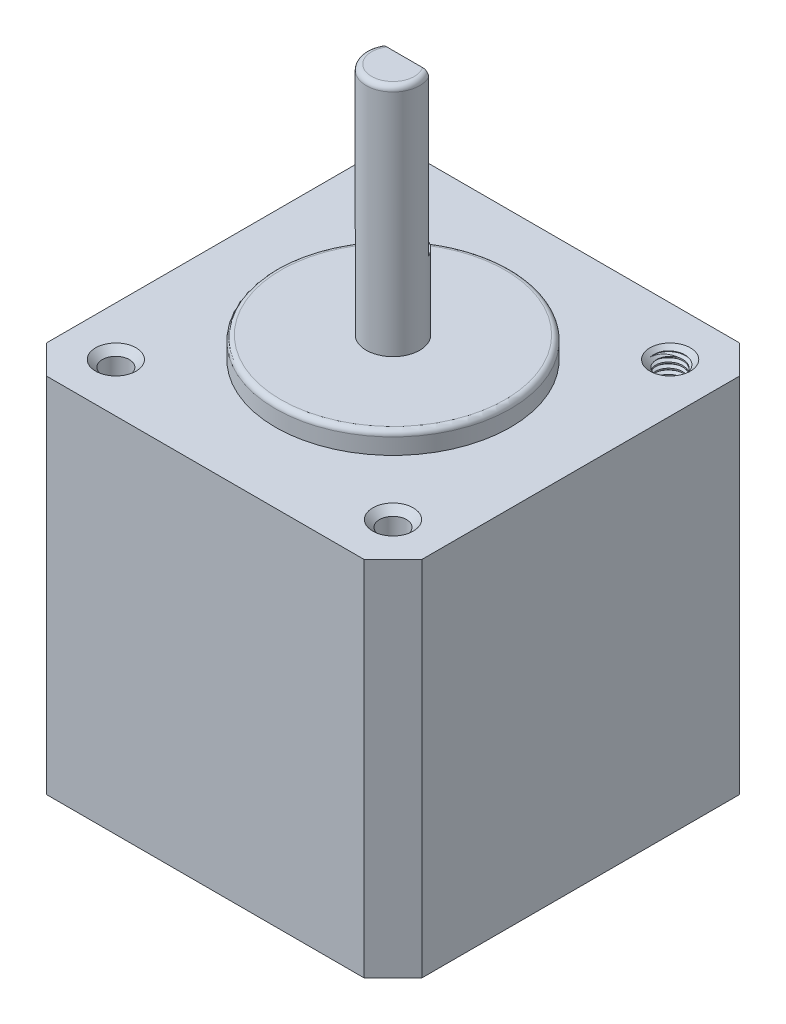
from build123d import *

# Parameters (mm, degrees)
SKETCH1_W                              = 35.2
SKETCH1_H                              = 35.2
BOSS_EXTRUDE1_DEPTH                    = 34
F_39_0_0995_DIAMETER_HOLE1_D           = 2.5273
F_39_0_0995_DIAMETER_HOLE1_DEPTH       = 4.536
F_39_0_0995_DIAMETER_HOLE1_CSINK_D     = 3.7973
F_39_0_0995_DIAMETER_HOLE1_CSINK_ANGLE = 90
F_39_0_0995_DIAMETER_HOLE1_TIP         = 0.759277521
M3_THREADS_PITCH                       = 0.5
SKETCH7_R                              = 11.025
COLLAR_DEPTH                           = 2
SKETCH8_R                              = 2.506
DRIVE_DEPTH                            = 22
DRIVE_START                            = -15
DRIVE_SLOT_DEPTH                       = 15
FILLET1_R                              = 0.5
BODY_CORNERS_DEPTH                     = 43.136919679
THREAD1_PITCH                          = 0.5


with BuildPart() as part:
    # Sketch1 → Boss-Extrude1 (new body)
    with BuildSketch(Plane(origin=(0, 0, 0), x_dir=(1, 0, 0), z_dir=(0, 1, 0))):
        Rectangle(SKETCH1_W, SKETCH1_H)
    extrude(amount=BOSS_EXTRUDE1_DEPTH)

    # #39 (0.0995) Diameter Hole1
    with Locations(Plane(origin=(0, 34, 0), x_dir=(1, 0, 0), z_dir=(0, 1, 0))):
        with Locations((13, -13), (13, 13), (-13, -13), (-13, 13)):
            CounterSinkHole(F_39_0_0995_DIAMETER_HOLE1_D / 2, F_39_0_0995_DIAMETER_HOLE1_CSINK_D / 2, depth=F_39_0_0995_DIAMETER_HOLE1_DEPTH, counter_sink_angle=F_39_0_0995_DIAMETER_HOLE1_CSINK_ANGLE)
            with Locations((0, 0, -(F_39_0_0995_DIAMETER_HOLE1_DEPTH + F_39_0_0995_DIAMETER_HOLE1_TIP / 2))):  # 118° drill point
                Cone(0, F_39_0_0995_DIAMETER_HOLE1_D / 2, F_39_0_0995_DIAMETER_HOLE1_TIP, mode=Mode.SUBTRACT)

    # M3 threads: the profile of Thread Profile3 profile screwed along a right-hand helix of 9 turns, 6 arcs to a turn; built about Z, then put on its axis
    m3_threads_z = Axis((0, 0, 0), (0, 0, 1))
    m3_threads_corners = [(1.26335, 0, -0.000173205), (1.534282937, 0, 0.156249999), (1.534282937, 0, 0.218749999), (1.26335, 0, 0.375173204)]
    with BuildLine(mode=Mode.PRIVATE) as m3_threads_profile:
        Line(m3_threads_corners[0], m3_threads_corners[1])
        Line(m3_threads_corners[1], m3_threads_corners[2])
        Line(m3_threads_corners[2], m3_threads_corners[3])
        Line(m3_threads_corners[3], m3_threads_corners[0])
    m3_threads_cap = Face(m3_threads_profile.wire())
    m3_threads_turn_angles = [0, 30, 60, 90, 120, 150, 180, 210, 240, 270, 300, 330, 360]
    m3_threads_turn_weights = [1, 0.8660254037844387, 1, 0.8660254037844387, 1, 0.8660254037844387, 1, 0.8660254037844387, 1, 0.8660254037844387, 1, 0.8660254037844387, 1]
    m3_threads_turn_rails = [Edge.make_bspline([Vector(p[0], p[1], 0).rotate(m3_threads_z, m3_threads_turn_angles[k]) / m3_threads_turn_weights[k] + Vector(0, 0, p[2] + M3_THREADS_PITCH * m3_threads_turn_angles[k] / 360) for k in range(13)], [0, 0, 0, 1, 1, 2, 2, 3, 3, 4, 4, 5, 5, 6, 6, 6], 2, m3_threads_turn_weights) for p in m3_threads_corners]
    m3_threads_turn_sides = [Face.make_surface_from_curves(m3_threads_turn_rails[p[0]], m3_threads_turn_rails[p[1]]) for p in [(0, 1), (1, 2), (2, 3), (3, 0)]]
    m3_threads_last_angles = [2880, 2910, 2940, 2970, 3000, 3030, 3060, 3090, 3120, 3150, 3180, 3209.9999604, 3239.9999208]
    m3_threads_last_weights = [1, 0.8660254037844387, 1, 0.8660254037844387, 1, 0.8660254037844387, 1, 0.8660254037844387, 1, 0.8660254037844387, 1, 0.866025749359424, 1]
    m3_threads_last_rails = [Edge.make_bspline([Vector(p[0], p[1], 0).rotate(m3_threads_z, m3_threads_last_angles[k]) / m3_threads_last_weights[k] + Vector(0, 0, p[2] + M3_THREADS_PITCH * m3_threads_last_angles[k] / 360) for k in range(13)], [0, 0, 0, 1, 1, 2, 2, 3, 3, 4, 4, 5, 5, 6, 6, 6], 2, m3_threads_last_weights) for p in m3_threads_corners]
    m3_threads_last_sides = [Face.make_surface_from_curves(m3_threads_last_rails[p[0]], m3_threads_last_rails[p[1]]) for p in [(0, 1), (1, 2), (2, 3), (3, 0)]]
    m3_threads = Plane(origin=(-13, 33.365, -13), x_dir=(-1, 0, 0), z_dir=(0, -1, 0)) * Solid(Shell([*[p.moved(Location((0, 0, M3_THREADS_PITCH * i))) for i in range(8) for p in m3_threads_turn_sides], *m3_threads_last_sides, m3_threads_cap, m3_threads_cap.rotate(m3_threads_z, 3239.9999208).moved(Location((0, 0, M3_THREADS_PITCH * 3239.9999208 / 360)))]))
    add(m3_threads, mode=Mode.SUBTRACT)

    # Sketch7 → collar (add)
    with BuildSketch(Plane(origin=(0, 34, 0), x_dir=(1, 0, 0), z_dir=(0, 1, 0))):
        with Locations(Location((0, 0, 0), (0, 0, 90))):
            Circle(SKETCH7_R)
    extrude(amount=COLLAR_DEPTH)

    # Sketch8 → drive (add)
    with BuildSketch(Plane(origin=(0, 36, 0), x_dir=(1, 0, 0), z_dir=(0, 1, 0))):
        with Locations(Location((0, 0, 0), (0, 0, 270))):
            Circle(SKETCH8_R)
    extrude(amount=DRIVE_DEPTH)

    # Sketch9 → drive slot (cut)
    with BuildSketch(Plane(origin=(0, 58, 0), x_dir=(1, 0, 0), z_dir=(0, 1, 0)).offset(DRIVE_START)):
        with BuildLine():
            Line((2.25, 1.103420138), (-2.25, 1.103420138))
            ThreePointArc((-2.25, 1.103420138), (0, 2.506), (2.25, 1.103420138))
        make_face()
    extrude(amount=DRIVE_SLOT_DEPTH, mode=Mode.SUBTRACT)

    # Fillet1
    fillet1_edges = [part.edges().sort_by_distance(p)[0] for p in [
        (0, 36, 11.025),
        (-2.12664135, 58, 1.325681926),
    ]]
    fillet(fillet1_edges, radius=FILLET1_R)

    # Sketch11 → body corners (cut, through all)
    with BuildSketch(Plane(origin=(0, 34, 0), x_dir=(1, 0, 0), z_dir=(0, 1, 0))):
        Polygon((-17.6, -14.89865), (-17.6, -17.6), (-14.89865, -17.6), align=None)
        Polygon((-14.89865, 17.6), (-17.6, 17.6), (-17.6, 14.89865), align=None)
        Polygon((17.6, 14.89865), (14.89865, 17.6), (17.6, 17.6), align=None)
        Polygon((17.6, -14.89865), (14.89865, -17.6), (17.6, -17.6), align=None)
    extrude(amount=-BODY_CORNERS_DEPTH, mode=Mode.SUBTRACT)

    # Thread1: the profile of Thread Profile4 profile screwed along a right-hand helix of 9.58 turns, 6 arcs to a turn; built about Z, then put on its axis
    thread1_z = Axis((0, 0, 0), (0, 0, 1))
    thread1_corners = [(1.26335, 0, -0.000173205), (1.534282937, 0, 0.156249999), (1.534282937, 0, 0.218749999), (1.26335, 0, 0.375173204)]
    with BuildLine(mode=Mode.PRIVATE) as thread1_profile:
        Line(thread1_corners[0], thread1_corners[1])
        Line(thread1_corners[1], thread1_corners[2])
        Line(thread1_corners[2], thread1_corners[3])
        Line(thread1_corners[3], thread1_corners[0])
    thread1_cap = Face(thread1_profile.wire())
    thread1_turn_angles = [0, 30, 60, 90, 120, 150, 180, 210, 240, 270, 300, 330, 360]
    thread1_turn_weights = [1, 0.8660254037844387, 1, 0.8660254037844387, 1, 0.8660254037844387, 1, 0.8660254037844387, 1, 0.8660254037844387, 1, 0.8660254037844387, 1]
    thread1_turn_rails = [Edge.make_bspline([Vector(p[0], p[1], 0).rotate(thread1_z, thread1_turn_angles[k]) / thread1_turn_weights[k] + Vector(0, 0, p[2] + THREAD1_PITCH * thread1_turn_angles[k] / 360) for k in range(13)], [0, 0, 0, 1, 1, 2, 2, 3, 3, 4, 4, 5, 5, 6, 6, 6], 2, thread1_turn_weights) for p in thread1_corners]
    thread1_turn_sides = [Face.make_surface_from_curves(thread1_turn_rails[p[0]], thread1_turn_rails[p[1]]) for p in [(0, 1), (1, 2), (2, 3), (3, 0)]]
    thread1_last_angles = [3240, 3270, 3300, 3330, 3360, 3390, 3420, 3434.4, 3448.8]
    thread1_last_weights = [1, 0.8660254037844387, 1, 0.8660254037844387, 1, 0.8660254037844387, 1, 0.9685831611286209, 1]
    thread1_last_rails = [Edge.make_bspline([Vector(p[0], p[1], 0).rotate(thread1_z, thread1_last_angles[k]) / thread1_last_weights[k] + Vector(0, 0, p[2] + THREAD1_PITCH * thread1_last_angles[k] / 360) for k in range(9)], [0, 0, 0, 1, 1, 2, 2, 3, 3, 4, 4, 4], 2, thread1_last_weights) for p in thread1_corners]
    thread1_last_sides = [Face.make_surface_from_curves(thread1_last_rails[p[0]], thread1_last_rails[p[1]]) for p in [(0, 1), (1, 2), (2, 3), (3, 0)]]
    thread1 = Plane(origin=(13, 29.21, -13), x_dir=(1, 0, 0), z_dir=(0, 1, 0)) * Solid(Shell([*[p.moved(Location((0, 0, THREAD1_PITCH * i))) for i in range(9) for p in thread1_turn_sides], *thread1_last_sides, thread1_cap, thread1_cap.rotate(thread1_z, 3448.8).moved(Location((0, 0, THREAD1_PITCH * 3448.8 / 360)))]))
    add(thread1, mode=Mode.SUBTRACT)


solid = part.part
